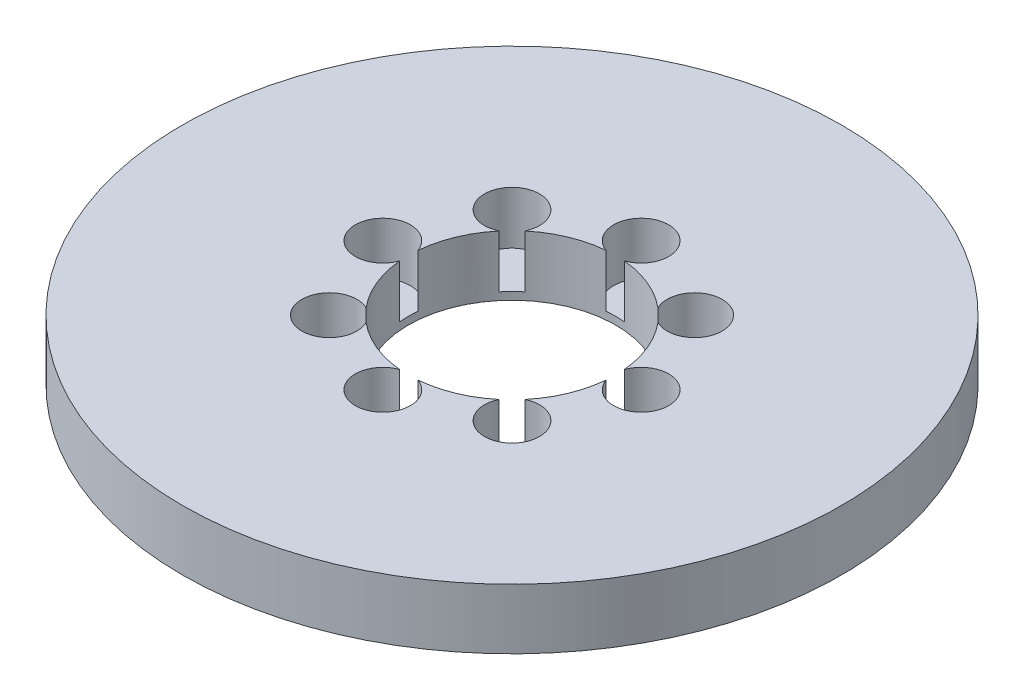
from build123d import *

# Parameters (mm, degrees)
SKETCH1_R           = 87.5
BOSS_EXTRUDE1_DEPTH = 16
SKETCH2_R           = 27.5
CUT_EXTRUDE1_DEPTH  = 125.773795326
SKETCH3_R           = 7.307789365
CUT_EXTRUDE2_DEPTH  = 13.994230173
CIRPATTERN1_COUNT   = 8


with BuildPart() as part:
    # Sketch1 → Boss-Extrude1 (new body)
    with BuildSketch(Plane(origin=(0, 0, 0), x_dir=(1, 0, 0), z_dir=(0, 1, 0))):
        Circle(SKETCH1_R)
    extrude(amount=BOSS_EXTRUDE1_DEPTH)

    # Sketch2 → Cut-Extrude1 (cut, through all)
    with BuildSketch(Plane(origin=(0, 0, 0), x_dir=(1, 0, 0), z_dir=(0, 1, 0))):
        Circle(SKETCH2_R)
    extrude(amount=CUT_EXTRUDE1_DEPTH, mode=Mode.SUBTRACT)

    # Sketch3 → Cut-Extrude2 (cut)
    with BuildSketch(Plane(origin=(0, 16, 0), x_dir=(1, 0, 0), z_dir=(0, 1, 0))):
        with Locations((-34.289217919, 0)):
            Circle(SKETCH3_R)
    cut_extrude2 = extrude(amount=-CUT_EXTRUDE2_DEPTH, mode=Mode.SUBTRACT)

    # CirPattern1: Cut-Extrude2 ×8 about axis
    cirpattern1_axis = Axis((0, 0, 0), (0, 1, 0))
    for i in range(1, CIRPATTERN1_COUNT):
        add(cut_extrude2.rotate(cirpattern1_axis, i * 360 / CIRPATTERN1_COUNT), mode=Mode.SUBTRACT)


solid = part.part
